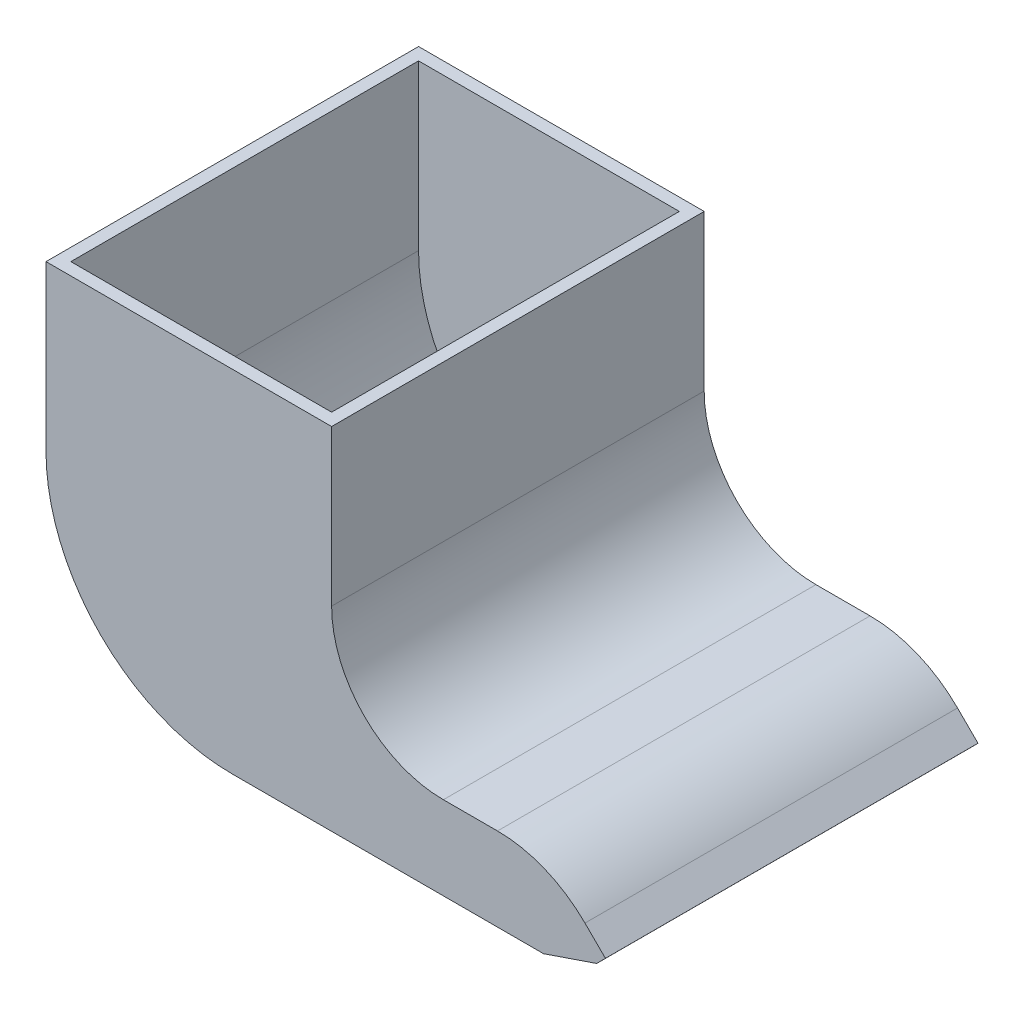
from build123d import *

# Parameters (mm, degrees)
EXTRUDE_THIN1_DEPTH   = 30
EXTRUDE_THIN1_2_DEPTH = 30
BOSS_EXTRUDE1_START   = -1
BOSS_EXTRUDE1_DEPTH   = 1
BOSS_EXTRUDE2_DEPTH   = 1
FILLET1_R             = 10
FILLET2_R             = 5


with BuildPart() as part:
    # Sketch1 → Extrude-Thin1 (new body)
    with BuildSketch(Plane.XY):
        with BuildLine():
            Line((0, 0), (0, -9.941978892))
            Line((0, -9.941978892), (0, -13.23222107))
            ThreePointArc((0, -13.23222107), (4.393398282, -23.838822788), (15, -28.23222107))
            Line((15, -28.23222107), (40.06481759, -28.23222107))
            Line((40.06481759, -28.23222107), (40.06481759, -27.23222107))
            Line((40.06481759, -27.23222107), (15, -27.23222107))
            ThreePointArc((15, -27.23222107), (5.100505063, -23.131716006), (1, -13.23222107))
            Line((1, -13.23222107), (1, -9.941978892))
            Line((1, -9.941978892), (1, 0))
            Line((1, 0), (0, 0))
        make_face()
    extrude(amount=EXTRUDE_THIN1_DEPTH)



with BuildPart() as body_2:
    # Sketch1 → Extrude-Thin1 2 (new body)
    with BuildSketch(Plane.XY):
        with BuildLine():
            Line((22, 0), (22, -9.941978892))
            Line((22, -9.941978892), (22, -12.525749024))
            ThreePointArc((22, -12.525749024), (24.928932188, -19.596816836), (32, -22.525749024))
            Line((32, -22.525749024), (40.06481759, -22.525749024))
            Line((40.06481759, -22.525749024), (44.344767003, -26.773486601))
            Line((44.344767003, -26.773486601), (45.049197787, -26.063713912))
            Line((45.049197787, -26.063713912), (40.476820184, -21.525749024))
            Line((40.476820184, -21.525749024), (32, -21.525749024))
            ThreePointArc((32, -21.525749024), (25.636038969, -18.889710055), (23, -12.525749024))
            Line((23, -12.525749024), (23, -9.941978892))
            Line((23, -9.941978892), (23, 0))
            Line((23, 0), (22, 0))
        make_face()
    extrude(amount=EXTRUDE_THIN1_2_DEPTH)


with BuildPart() as part_1:
    add(part.part)

    add(body_2.part)  # Boss-Extrude1 merges body 2
    # Sketch2 → Boss-Extrude1 (add)
    with BuildSketch(Plane.XY.offset(30).offset(BOSS_EXTRUDE1_START)):
        with BuildLine():
            Line((40.476820184, -21.525749024), (32, -21.525749024))
            ThreePointArc((32, -21.525749024), (25.636038969, -18.889710055), (23, -12.525749024))
            Line((23, -12.525749024), (23, 0))
            Line((23, 0), (22, 0))
            Line((22, 0), (1, 0))
            Line((1, 0), (0, 0))
            Line((0, 0), (0, -13.23222107))
            ThreePointArc((0, -13.23222107), (4.393398282, -23.838822788), (15, -28.23222107))
            Line((15, -28.23222107), (40.06481759, -28.23222107))
            Line((40.06481759, -28.23222107), (44.344767003, -26.773486601))
            Line((44.344767003, -26.773486601), (45.049197787, -26.063713912))
            Line((45.049197787, -26.063713912), (40.476820184, -21.525749024))
        make_face()
    extrude(amount=BOSS_EXTRUDE1_DEPTH)

    # Sketch3 → Boss-Extrude2 (add)
    with BuildSketch(Plane(origin=(0, 0, 0), x_dir=(-1, 0, 0), z_dir=(0, 0, -1))):
        with BuildLine():
            Line((-44.344767003, -26.773486601), (-40.06481759, -28.23222107))
            Line((-40.06481759, -28.23222107), (-15, -28.23222107))
            ThreePointArc((-15, -28.23222107), (-4.393398282, -23.838822788), (0, -13.23222107))
            Line((0, -13.23222107), (0, 0))
            Line((0, 0), (-1, 0))
            Line((-1, 0), (-22, 0))
            Line((-22, 0), (-23, 0))
            Line((-23, 0), (-23, -12.525749024))
            ThreePointArc((-23, -12.525749024), (-25.636038969, -18.889710055), (-32, -21.525749024))
            Line((-32, -21.525749024), (-40.476820184, -21.525749024))
            Line((-40.476820184, -21.525749024), (-45.049197787, -26.063713912))
            Line((-45.049197787, -26.063713912), (-44.344767003, -26.773486601))
        make_face()
    extrude(amount=-BOSS_EXTRUDE2_DEPTH)

    # Fillet1
    fillet1_edges = [part_1.edges().sort_by_distance(p)[0] for p in [
        (40.476820184, -21.525749024, 15),
        (40.06481759, -22.525749024, 15),
    ]]
    fillet(fillet1_edges, radius=FILLET1_R)

    # Fillet2
    # the kernel refuses this fillet: 5 mm, written as the material it takes off along each edge
    with BuildSketch(Plane(origin=(40.06481759, -27.23222107, 1), x_dir=(0, -1, 0), z_dir=(0, 0, 1))) as fillet2_piece_1:
        with BuildLine():
            CenterArc((5, -3), FILLET2_R, 143.130102354, 36.869897646)
            Line((0, -3), (0, 0))
            Line((0, 0), (1, 0))
        make_face()
    extrude(amount=28, mode=Mode.SUBTRACT)


solid = part_1.part
